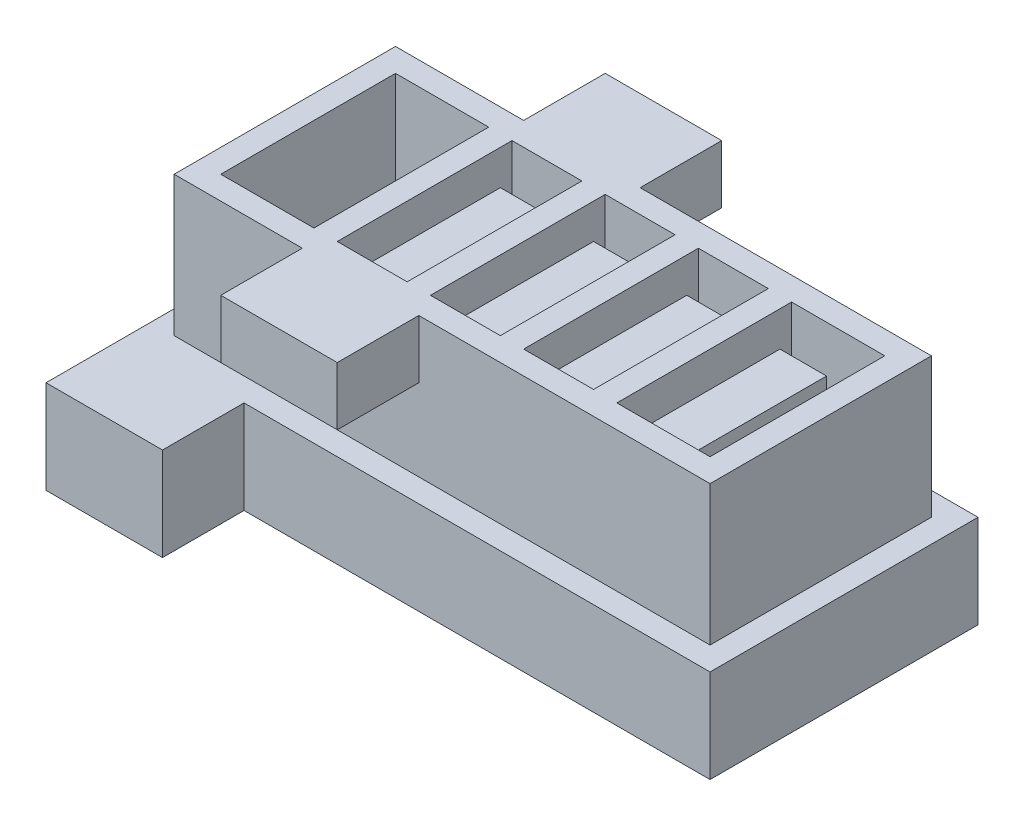
from build123d import *

# Parameters (mm, degrees)
SKETCH1_W                = 6
SKETCH1_H                = 15
BOSS_EXTRUDE1_DEPTH      = 15
SKETCH2_W                = 4
SKETCH2_H                = 11
CUT_EXTRUDE1_DEPTH       = 13
SKETCH3_W                = 15
SKETCH3_H                = 4
BOSS_EXTRUDE2_DEPTH      = 2
LPATTERN1_COUNT          = 4
LPATTERN1_PITCH          = 8
SKETCH4_W                = 15
SKETCH4_H                = 15
BOSS_EXTRUDE3_DEPTH      = 8
SKETCH5_W                = 4
SKETCH5_H                = 11
CUT_EXTRUDE2_DEPTH       = 5.5
SKETCH6_W                = 15
SKETCH6_H                = 15
BOSS_EXTRUDE4_DEPTH      = 2
SKETCH7_W                = 36
SKETCH7_H                = 2
CUT_EXTRUDE3_DEPTH       = 2
BOSS_EXTRUDE5_DEPTH      = 5
BOSS_EXTRUDE5_DEPTH_BACK = 15
SKETCH8_W                = 35
SKETCH8_H                = 19
BOSS_EXTRUDE6_DEPTH      = 5
BOSS_EXTRUDE6_DEPTH_BACK = 15
SKETCH9_W                = 11
SKETCH9_H                = 19
SPLIT1_START             = -5
SPLIT1_OUTLINE_W         = 46
SPLIT1_OUTLINE_H         = 19
SPLIT1_DEPTH             = 5
SPLIT1_2_OUTLINE_W       = 4
SPLIT1_2_OUTLINE_H       = 11
SPLIT1_2_DEPTH           = 13
SPLIT1_3_OUTLINE_W       = 4
SPLIT1_3_OUTLINE_H       = 2
SPLIT1_3_DEPTH           = 2
SPLIT1_START_2           = -13
SPLIT1_4_DEPTH           = 11
SPLIT1_START_3           = -17
SPLIT1_5_OUTLINE_W       = 46
SPLIT1_5_OUTLINE_H       = 5
SPLIT1_5_DEPTH           = 19
SPLIT1_START_4           = -8.5
SPLIT1_6_OUTLINE_W       = 4
SPLIT1_6_OUTLINE_H       = 2
SPLIT1_6_DEPTH           = 2
SKETCH15_W               = 10
SKETCH15_H               = 5
BOSS_EXTRUDE13_DEPTH     = 7
SKETCH16_W               = 10
SKETCH16_H               = 5
BOSS_EXTRUDE14_DEPTH     = 7
SKETCH17_W               = 50
SKETCH17_H               = 23
SKETCH17_W_2             = 46
SKETCH17_H_2             = 19
BOSS_EXTRUDE15_DEPTH     = 8
SKETCH18_W               = 10
SKETCH18_H               = 8
BOSS_EXTRUDE16_DEPTH     = 7
SKETCH19_W               = 10
SKETCH19_H               = 8
BOSS_EXTRUDE17_DEPTH     = 7


# Read off the part's stored shape, not the designer's step: Split1
with BuildPart() as part:
    # Sketch1 → Boss-Extrude1 (new body)
    with BuildSketch(Plane(origin=(0, 0, 0), x_dir=(1, 0, 0), z_dir=(0, 1, 0))):
        with Locations((3, 7.5)):
            Rectangle(SKETCH1_W, SKETCH1_H)
    extrude(amount=BOSS_EXTRUDE1_DEPTH)

    # Sketch2 → Cut-Extrude1 (cut)
    with BuildSketch(Plane.XZ):
        with Locations((3, -7.5)):
            Rectangle(SKETCH2_W, SKETCH2_H)
    extrude(amount=-CUT_EXTRUDE1_DEPTH, mode=Mode.SUBTRACT)

    # Sketch3 → Boss-Extrude2 (add)
    with BuildSketch(Plane.ZY):
        with Locations((-7.5, 2)):
            Rectangle(SKETCH3_W, SKETCH3_H)
    extrude(amount=BOSS_EXTRUDE2_DEPTH)


with BuildPart() as lpattern1_1:
    # LPattern1: pattern copy
    add(part.part.moved(Location(Vector(-1, 0, 0) * (1 * LPATTERN1_PITCH))))


with BuildPart() as lpattern1_2:
    # LPattern1: pattern copy
    add(part.part.moved(Location(Vector(-1, 0, 0) * (2 * LPATTERN1_PITCH))))


with BuildPart() as lpattern1_3:
    # LPattern1: pattern copy
    add(part.part.moved(Location(Vector(-1, 0, 0) * (3 * LPATTERN1_PITCH))))

    # Sketch4 → Boss-Extrude3 (add)
    with BuildSketch(Plane.ZY.offset(26)):
        with Locations((-7.5, 7.5)):
            Rectangle(SKETCH4_W, SKETCH4_H)
    extrude(amount=BOSS_EXTRUDE3_DEPTH)

    # Sketch5 → Cut-Extrude2 (cut)
    with BuildSketch(Plane.XZ):
        with Locations((-29, -7.5)):
            Rectangle(SKETCH5_W, SKETCH5_H)
    extrude(amount=-CUT_EXTRUDE2_DEPTH, mode=Mode.SUBTRACT)


with BuildPart() as lpattern1_1_1:
    add(lpattern1_1.part)

    # Combine1: union LPattern1_2, LPattern1_3, part
    add(lpattern1_2.part)
    add(lpattern1_3.part)
    add(part.part)

    # Sketch6 → Boss-Extrude4 (add)
    with BuildSketch(Plane(origin=(6, 0, 0), x_dir=(0, 0, -1), z_dir=(1, 0, 0))):
        with Locations((7.5, 7.5)):
            Rectangle(SKETCH6_W, SKETCH6_H)
    extrude(amount=BOSS_EXTRUDE4_DEPTH)

    # Sketch7 → Cut-Extrude3 (cut)
    with BuildSketch(Plane.XZ):
        with Locations((-13, -7.5)):
            Rectangle(SKETCH7_W, SKETCH7_H)
    extrude(amount=-CUT_EXTRUDE3_DEPTH, mode=Mode.SUBTRACT)


with BuildPart() as body_2:
    # Sketch8 → Boss-Extrude5 (new, two sides: drawn at the far end of the back side and taken through both)
    with BuildSketch(Plane.XZ.offset(-BOSS_EXTRUDE5_DEPTH_BACK)):
        with Locations((-7.5, -7.5)):
            Rectangle(SKETCH8_W, SKETCH8_H)
    extrude(amount=BOSS_EXTRUDE5_DEPTH + BOSS_EXTRUDE5_DEPTH_BACK)


with BuildPart() as body_3:
    # Sketch9 → Boss-Extrude6 (new, two sides: drawn at the far end of the back side and taken through both)
    with BuildSketch(Plane.XZ.offset(-BOSS_EXTRUDE6_DEPTH_BACK)):
        with Locations((-30.5, -7.5)):
            Rectangle(SKETCH9_W, SKETCH9_H)
    extrude(amount=BOSS_EXTRUDE6_DEPTH + BOSS_EXTRUDE6_DEPTH_BACK)


with BuildPart() as body_2_1:
    add(body_2.part)

    # Combine3: union body 3
    add(body_3.part)

    # Combine4: cut LPattern1_1
    add(lpattern1_1_1.part, mode=Mode.SUBTRACT)

    # Split1 outline → Split1 (cut)
    with BuildSketch(Plane(origin=(0, 0, 0), x_dir=(1, 0, 0), z_dir=(0, 1, 0)).offset(SPLIT1_START)):
        with Locations((-13, 7.5)):
            Rectangle(SPLIT1_OUTLINE_W, SPLIT1_OUTLINE_H)
    extrude(amount=SPLIT1_DEPTH, mode=Mode.SUBTRACT)

    # Split1 2 outline → Split1 2 (cut)
    with BuildSketch(Plane(origin=(0, 0, 0), x_dir=(1, 0, 0), z_dir=(0, 1, 0))):
        with Locations((-5, 7.5)):
            Rectangle(SPLIT1_2_OUTLINE_W, SPLIT1_2_OUTLINE_H)
        with Locations((3, 7.5)):
            Rectangle(SPLIT1_2_OUTLINE_W, SPLIT1_2_OUTLINE_H)
        with Locations((-13, 7.5)):
            Rectangle(SPLIT1_2_OUTLINE_W, SPLIT1_2_OUTLINE_H)
        with Locations((-21, 7.5)):
            Rectangle(SPLIT1_2_OUTLINE_W, SPLIT1_2_OUTLINE_H)
        with Locations((-29, 7.5)):
            Rectangle(SPLIT1_2_OUTLINE_W, SPLIT1_2_OUTLINE_H)
    extrude(amount=SPLIT1_2_DEPTH, mode=Mode.SUBTRACT)

    # Split1 3 outline → Split1 3 (cut)
    with BuildSketch(Plane(origin=(0, 0, 0), x_dir=(1, 0, 0), z_dir=(0, 1, 0))):
        with Locations((-1, 7.5)):
            Rectangle(SPLIT1_3_OUTLINE_W, SPLIT1_3_OUTLINE_H)
        with Locations((-9, 7.5)):
            Rectangle(SPLIT1_3_OUTLINE_W, SPLIT1_3_OUTLINE_H)
        with Locations((-17, 7.5)):
            Rectangle(SPLIT1_3_OUTLINE_W, SPLIT1_3_OUTLINE_H)
        with Locations((-25, 7.5)):
            Rectangle(SPLIT1_3_OUTLINE_W, SPLIT1_3_OUTLINE_H)
    extrude(amount=SPLIT1_3_DEPTH, mode=Mode.SUBTRACT)

    # Sketch15 → Boss-Extrude13 (add)
    with BuildSketch(Plane.XY.offset(2)):
        with Locations((-20, 12.5)):
            Rectangle(SKETCH15_W, SKETCH15_H)
    extrude(amount=BOSS_EXTRUDE13_DEPTH)

    # Sketch16 → Boss-Extrude14 (add)
    with BuildSketch(Plane(origin=(0, 0, -17), x_dir=(-1, 0, 0), z_dir=(0, 0, -1))):
        with Locations((20, 12.5)):
            Rectangle(SKETCH16_W, SKETCH16_H)
    extrude(amount=BOSS_EXTRUDE14_DEPTH)


with BuildPart() as body_2_2:
    # Split1 4 outline → Split1 4 (new body)
    with BuildSketch(Plane.XY.offset(SPLIT1_START_2)):
        Polygon((-27, 5.5), (-31, 5.5), (-31, 0), (-36, 0), (-36, -5), (10, -5), (10, 0), (5, 0), (5, 13), (1, 13), (1, 0), (-3, 0), (-3, 13), (-7, 13), (-7, 0), (-11, 0), (-11, 13), (-15, 13), (-15, 0), (-19, 0), (-19, 13), (-23, 13), (-23, 0), (-27, 0), align=None)
    extrude(amount=SPLIT1_4_DEPTH)

    # Split1 5 outline → Split1 5 (add)
    with BuildSketch(Plane.XY.offset(SPLIT1_START_3)):
        with Locations((-13, -2.5)):
            Rectangle(SPLIT1_5_OUTLINE_W, SPLIT1_5_OUTLINE_H)
    extrude(amount=SPLIT1_5_DEPTH)

    # Split1 6 outline → Split1 6 (add)
    with BuildSketch(Plane.XY.offset(SPLIT1_START_4)):
        with Locations((-25, 1)):
            Rectangle(SPLIT1_6_OUTLINE_W, SPLIT1_6_OUTLINE_H)
        with Locations((-17, 1)):
            Rectangle(SPLIT1_6_OUTLINE_W, SPLIT1_6_OUTLINE_H)
        with Locations((-9, 1)):
            Rectangle(SPLIT1_6_OUTLINE_W, SPLIT1_6_OUTLINE_H)
        with Locations((-1, 1)):
            Rectangle(SPLIT1_6_OUTLINE_W, SPLIT1_6_OUTLINE_H)
    extrude(amount=SPLIT1_6_DEPTH)

    # Sketch17 → Boss-Extrude15 (add)
    with BuildSketch(Plane.XZ.offset(5)):
        with Locations((-13, -7.5)):
            Rectangle(SKETCH17_W, SKETCH17_H)
        with Locations((-13, -7.5)):
            Rectangle(SKETCH17_W_2, SKETCH17_H_2, mode=Mode.SUBTRACT)
    extrude(amount=-BOSS_EXTRUDE15_DEPTH)

    # Sketch18 → Boss-Extrude16 (add)
    with BuildSketch(Plane.XY.offset(4)):
        with Locations((-33, -1)):
            Rectangle(SKETCH18_W, SKETCH18_H)
    extrude(amount=BOSS_EXTRUDE16_DEPTH)

    # Sketch19 → Boss-Extrude17 (add)
    with BuildSketch(Plane(origin=(0, 0, -19), x_dir=(-1, 0, 0), z_dir=(0, 0, -1))):
        with Locations((33, -1)):
            Rectangle(SKETCH19_W, SKETCH19_H)
    extrude(amount=BOSS_EXTRUDE17_DEPTH)


solid = Compound([body_2_1.part, body_2_2.part])
